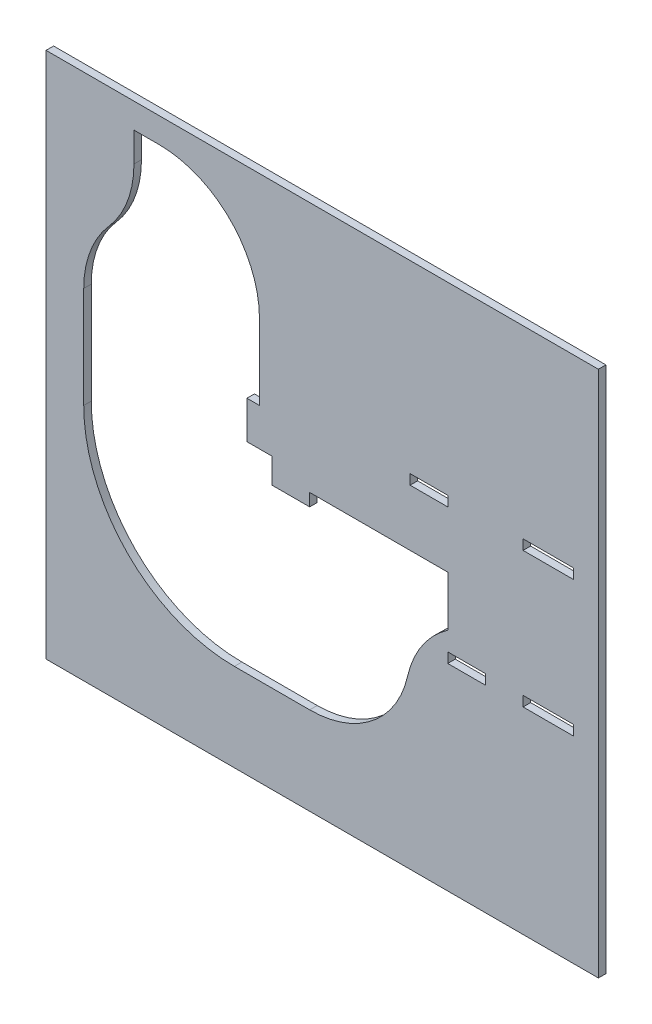
from build123d import *

# Parameters (mm, degrees)
BOSS_EXTRUDE1_DEPTH = 0.15
FILLET3_R           = 6
FILLET4_R           = 4
FILLET5_R           = 4
FILLET7_R           = 4
SKETCH3_W           = 2
SKETCH3_H           = 0.4
SKETCH3_W_2         = 1.5
CUT_EXTRUDE1_DEPTH  = 29.321193478


with BuildPart() as part:
    # Sketch1 → Boss-Extrude1 (new, symmetric)
    with BuildSketch(Plane.XY):
        Polygon((0, 0), (-19, 0), (-19, 21), (0, 21), (3, 21), (3, 0), align=None)
        Polygon((-8.5, 11), (-3, 11), (-3, 9), (-4.5, 9), (-4.5, 3.5), (-17.5, 3.5), (-17.5, 17), (-15.5, 17), (-15.5, 20), (-10.5, 20), (-10.5, 13), (-11, 13), (-11, 11.5), (-10, 11.5), (-10, 10.5), (-8.5, 10.5), align=None, mode=Mode.SUBTRACT)
    extrude(amount=BOSS_EXTRUDE1_DEPTH, both=True)

    # Fillet3
    fillet3_edges = [part.edges().sort_by_distance(p)[0] for p in [
        (-17.5, 3.5, 0),
    ]]
    fillet(fillet3_edges, radius=FILLET3_R)

    # Fillet4
    # the kernel refuses this fillet: 4 mm, written as the material it adds along each edge
    with BuildSketch(Plane(origin=(-17.5, 17, 0.15), x_dir=(0, -1, 0), z_dir=(0, 0, -1))) as fillet4_piece_1:
        with BuildLine():
            CenterArc((3.464101615, -4), FILLET4_R, 90, 60)
            Line((0, -2), (-0.069282032, -1.96))
            ThreePointArc((-0.069282032, -1.96), (-0.08, -1), (-0.08, 0))
            Line((-0.08, 0), (0, 0.08))
            Line((0, 0.08), (3.464101615, 0.08))
            Line((3.464101615, 0.08), (3.464101615, 0))
        make_face()
    extrude(amount=0.3)
    with BuildSketch(Plane(origin=(-4.5, 3.5, 0.15), x_dir=(-1, 0, 0), z_dir=(0, 0, -1))) as fillet4_piece_2:
        with BuildLine():
            CenterArc((FILLET4_R, FILLET4_R), FILLET4_R, 180, 90)
            Line((0, FILLET4_R), (-FILLET4_R * 0.02, FILLET4_R))
            Line((-FILLET4_R * 0.02, FILLET4_R), (-FILLET4_R * 0.02, -FILLET4_R * 0.02))
            Line((-FILLET4_R * 0.02, -FILLET4_R * 0.02), (FILLET4_R, -FILLET4_R * 0.02))
            Line((FILLET4_R, -FILLET4_R * 0.02), (FILLET4_R, 0))
        make_face()
    extrude(amount=0.3)

    # Fillet5
    # the kernel refuses this fillet: 4 mm, written as the material it takes off along each edge
    with BuildSketch(Plane(origin=(-15.5, 17, 4.718502517), x_dir=(0, 1, 0), z_dir=(0, 0, -1))) as fillet5_piece_1:
        with BuildLine():
            CenterArc((1.827401007, -4), FILLET5_R, 90, 41.409622109)
            Line((-0.818350304, -1), (-0.87126533, -0.94))
            ThreePointArc((-0.87126533, -0.94), (-0.430439522, -0.482598297), (-0.069282032, 0.04))
            Line((-0.069282032, 0.04), (0, 0.08))
            Line((0, 0.08), (1.827401007, 0.08))
            Line((1.827401007, 0.08), (1.827401007, 0))
        make_face()
    extrude(amount=9.437005035, mode=Mode.SUBTRACT)
    with BuildSketch(Plane(origin=(-4.5, 9, 6.119736906), x_dir=(-0.041592927859064134, -0.9991346397518759, 0), z_dir=(0, 0, -1))) as fillet5_piece_2:
        with BuildLine():
            CenterArc((3.110715854, -3.934149167), FILLET5_R, 100.410842639, 42.081908104)
            Line((-0.062389392, -1.49870196), (-0.379699916, -1.255157239))
            ThreePointArc((-0.379699916, -1.255157239), (-0.430848552, -0.732713809), (-0.399653856, 0.016637171))
            Line((-0.399653856, 0.016637171), (0.016637171, 0.399653856))
            ThreePointArc((0.016637171, 0.399653856), (1.515339131, 0.337264464), (2.315612653, 0.393414917))
            Line((2.315612653, 0.393414917), (2.387894762, 0))
        make_face()
    extrude(amount=12.239473812, mode=Mode.SUBTRACT)

    # Fillet7
    fillet7_edges = [part.edges().sort_by_distance(p)[0] for p in [
        (-10.5, 20, 0),
    ]]
    fillet(fillet7_edges, radius=FILLET7_R)

    # Sketch3 → Cut-Extrude1 (cut, through all)
    with BuildSketch(Plane.XY.offset(0.15)):
        with Locations((1, 8.05)):
            Rectangle(SKETCH3_W, SKETCH3_H)
        with Locations((-2.25, 8.05)):
            Rectangle(SKETCH3_W_2, SKETCH3_H)
        with Locations((1, 13.45)):
            Rectangle(SKETCH3_W, SKETCH3_H)
        with Locations((-3.75, 13.45)):
            Rectangle(SKETCH3_W_2, SKETCH3_H)
    extrude(amount=-CUT_EXTRUDE1_DEPTH, mode=Mode.SUBTRACT)


solid = part.part
